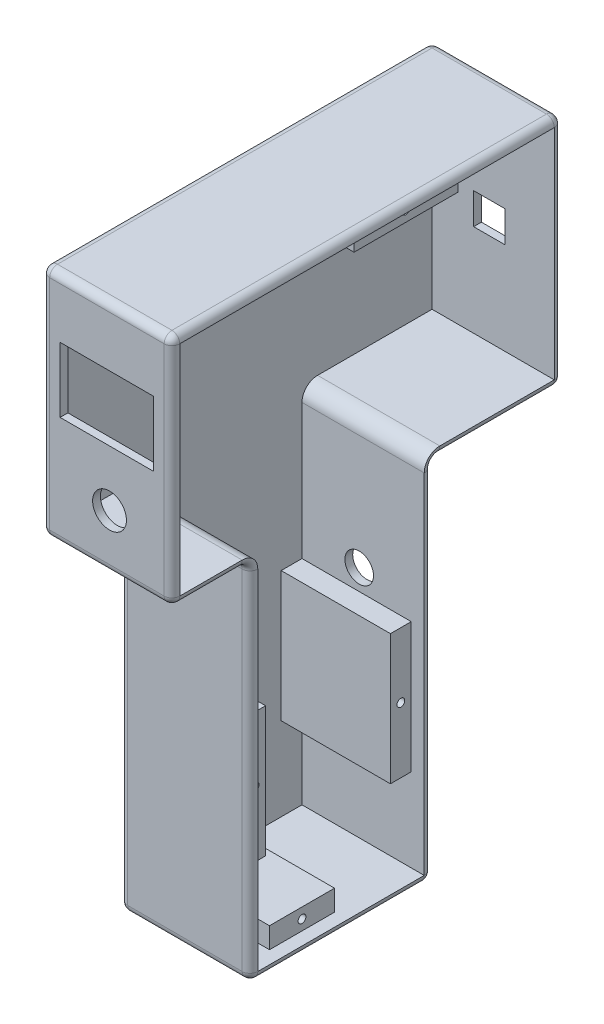
from build123d import *

# Parameters (mm, degrees)
BOSS_EXTRU_1_DEPTH      = 50
CONG_1_R                = 3
COQUE2_START            = 3
COQUE2_DEPTH            = 47
ESQUISSE2_W             = 40
ESQUISSE2_H             = 8
ESQUISSE2_R             = 1.5
ESQUISSE2_W_2           = 8
ESQUISSE2_H_2           = 50
ESQUISSE2_W_3           = 25
BOSS_EXTRU_3_DEPTH      = 42
ESQUISSE3_W             = 36
ESQUISSE3_H             = 25
ENL_V_MAT_EXTRU_1_DEPTH = 10
ESQUISSE5_R             = 6.5
ENL_V_MAT_EXTRU_2_DEPTH = 10
ESQUISSE6_R             = 5.5
ENL_V_MAT_EXTRU_3_DEPTH = 10
ESQUISSE7_W             = 12
ESQUISSE7_H             = 12
ENL_V_MAT_EXTRU_4_DEPTH = 10


# Read off the part's stored shape, not the designer's step: Coque2
with BuildPart() as part:
    # Esquisse1 → Boss.-Extru.1 (new body)
    with BuildSketch(Plane(origin=(0, 0, 0), x_dir=(0, 0, -1), z_dir=(1, 0, 0))):
        Polygon((0, 0), (70, 0), (70, 140), (120, 140), (120, 230), (-30, 230), (-30, 140), (0, 140), align=None)
    extrude(amount=BOSS_EXTRU_1_DEPTH)

    # Congé1
    cong_1_edges = [part.edges().sort_by_distance(p)[0] for p in [
        (0, 140, -95),
        (0, 70, -70),
        (0, 0, -35),
        (0, 70, 0),
        (50, 70, -70),
        (25, 140, 0),
        (25, 140, 30),
        (25, 230, 30),
        (25, 230, -120),
        (25, 140, -120),
        (25, 140, -70),
        (25, 0, -70),
        (25, 0, 0),
        (50, 140, -95),
        (50, 185, -120),
        (50, 230, -45),
        (50, 185, 30),
        (50, 140, 15),
        (50, 70, 0),
        (0, 140, 15),
        (50, 0, -35),
        (0, 185, 30),
        (0, 230, -45),
        (0, 185, -120),
    ]]
    fillet(cong_1_edges, radius=CONG_1_R)

    # Coque2 outline → Coque2 (cut)
    with BuildSketch(Plane.YZ.offset(COQUE2_START)):
        with BuildLine():
            Line((137, -3), (3, -3))
            Line((3, -3), (3, -67))
            Line((3, -67), (137, -67))
            ThreePointArc((137, -67), (141.242640687, -68.757359313), (143, -73))
            Line((143, -73), (143, -117))
            Line((143, -117), (227, -117))
            Line((227, -117), (227, 27))
            Line((227, 27), (143, 27))
            Line((143, 27), (143, 3))
            ThreePointArc((143, 3), (141.242640687, -1.242640687), (137, -3))
        make_face()
    extrude(amount=COQUE2_DEPTH, mode=Mode.SUBTRACT)

    # Esquisse2 → Boss.-Extru.3 (add)
    # profile 1 of 4: a face of its own
    with BuildSketch(Plane(origin=(3, 0, 0), x_dir=(0, 0, -1), z_dir=(1, 0, 0))):
        with Locations((65, 223)):
            Rectangle(ESQUISSE2_W, ESQUISSE2_H)
        with Locations(Location((65, 223, 0), (0, 0, 180))):
            Circle(ESQUISSE2_R, mode=Mode.SUBTRACT)
    # profile 2 of 4: a face of its own
    with BuildSketch(Plane(origin=(3, 0, 0), x_dir=(0, 0, -1), z_dir=(1, 0, 0))):
        with Locations((7, 60)):
            Rectangle(ESQUISSE2_W_2, ESQUISSE2_H_2)
        with Locations(Location((7, 60, 0), (0, 0, 180))):
            Circle(ESQUISSE2_R, mode=Mode.SUBTRACT)
    # profile 3 of 4: a face of its own
    with BuildSketch(Plane(origin=(3, 0, 0), x_dir=(0, 0, -1), z_dir=(1, 0, 0))):
        with Locations((63, 60)):
            Rectangle(ESQUISSE2_W_2, ESQUISSE2_H_2)
        with Locations(Location((63, 60, 0), (0, 0, 180))):
            Circle(ESQUISSE2_R, mode=Mode.SUBTRACT)
    # profile 4 of 4: a face of its own
    with BuildSketch(Plane(origin=(3, 0, 0), x_dir=(0, 0, -1), z_dir=(1, 0, 0))):
        with Locations((25, 7)):
            Rectangle(ESQUISSE2_W_3, ESQUISSE2_H)
        with Locations(Location((25, 7, 0), (0, 0, 180))):
            Circle(ESQUISSE2_R, mode=Mode.SUBTRACT)
    extrude(amount=BOSS_EXTRU_3_DEPTH)

    # Esquisse3 → Enlèv. mat.-Extru.1 (cut)
    with BuildSketch(Plane.XY.offset(30)):
        with Locations((25, 195)):
            Rectangle(ESQUISSE3_W, ESQUISSE3_H)
    extrude(amount=-ENL_V_MAT_EXTRU_1_DEPTH, mode=Mode.SUBTRACT)

    # Esquisse5 → Enlèv. mat.-Extru.2 (cut)
    with BuildSketch(Plane.XY.offset(30)):
        with Locations((26, 161)):
            Circle(ESQUISSE5_R)
    extrude(amount=-ENL_V_MAT_EXTRU_2_DEPTH, mode=Mode.SUBTRACT)

    # Esquisse6 → Enlèv. mat.-Extru.3 (cut)
    with BuildSketch(Plane(origin=(0, 0, -70), x_dir=(-1, 0, 0), z_dir=(0, 0, -1))):
        with Locations((-25, 93)):
            Circle(ESQUISSE6_R)
    extrude(amount=-ENL_V_MAT_EXTRU_3_DEPTH, mode=Mode.SUBTRACT)

    # Esquisse7 → Enlèv. mat.-Extru.4 (cut)
    with BuildSketch(Plane(origin=(0, 0, -120), x_dir=(-1, 0, 0), z_dir=(0, 0, -1))):
        with Locations((-25, 184.5)):
            Rectangle(ESQUISSE7_W, ESQUISSE7_H)
    extrude(amount=-ENL_V_MAT_EXTRU_4_DEPTH, mode=Mode.SUBTRACT)


solid = part.part
